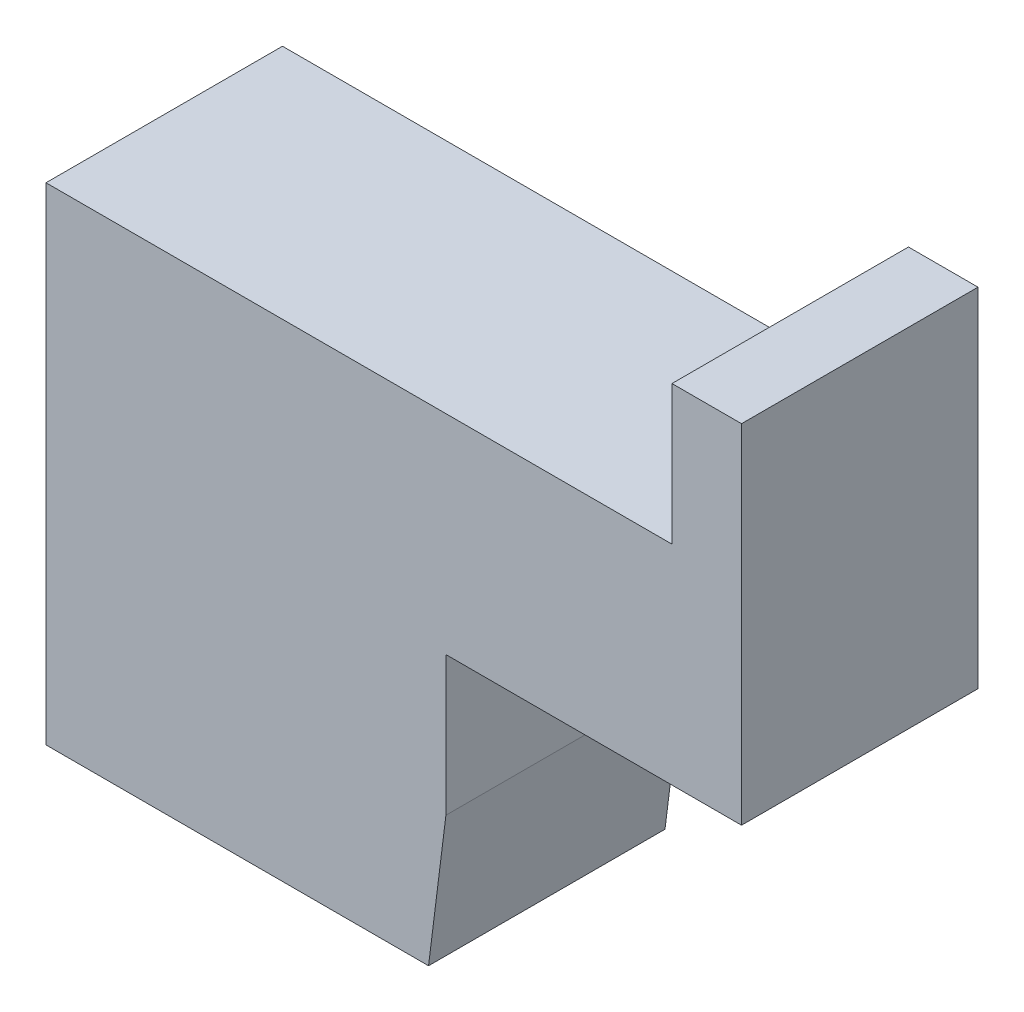
from build123d import *

# Parameters (mm, degrees)
BOSS_EXTRUDE1_DEPTH = 34


with BuildPart() as part:
    # Sketch1 → Boss-Extrude1 (new body)
    with BuildSketch(Plane.XY):
        Polygon((-16.018099548, 10.610859729), (23.981900452, 10.610859729), (23.981900452, 40.610859729), (23.981900452, 60.610859729), (13.981900452, 60.610859729), (13.981900452, 40.610859729), (-76.018099548, 40.610859729), (-76.018099548, 10.610859729), (-76.018099548, -29.389140271), (-21.018099548, -29.389140271), (-18.518099548, -9.389140271), (-18.518099548, 10.610859729), align=None)
    extrude(amount=BOSS_EXTRUDE1_DEPTH)


solid = part.part
